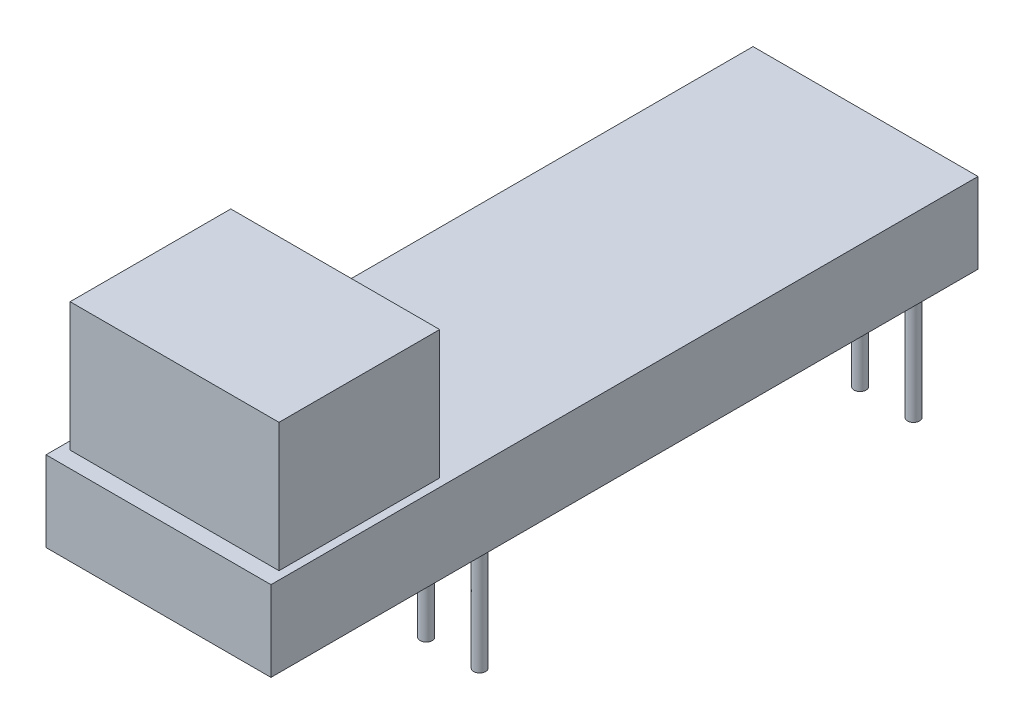
from build123d import *

# Parameters (mm, degrees)
SKETCH2_W           = 14
SKETCH2_H           = 44
BOSS_EXTRUDE1_DEPTH = 5
SKETCH3_W           = 13
SKETCH3_H           = 10
BOSS_EXTRUDE2_DEPTH = 8
SKETCH4_R           = 0.375
BOSS_EXTRUDE3_DEPTH = 8
LPATTERN1_COUNT     = 2
LPATTERN1_PITCH     = 27


with BuildPart() as part:
    # Sketch2 → Boss-Extrude1 (new body)
    with BuildSketch(Plane(origin=(0, 0, 0), x_dir=(1, 0, 0), z_dir=(0, 1, 0))):
        Rectangle(SKETCH2_W, SKETCH2_H)
    extrude(amount=BOSS_EXTRUDE1_DEPTH)

    # Sketch3 → Boss-Extrude2 (add)
    with BuildSketch(Plane(origin=(0, 5, 0), x_dir=(1, 0, 0), z_dir=(0, 1, 0))):
        with Locations((0, -16)):
            Rectangle(SKETCH3_W, SKETCH3_H)
    extrude(amount=BOSS_EXTRUDE2_DEPTH)

    # Sketch4 → Boss-Extrude3 (add)
    with BuildSketch(Plane.XZ):
        with Locations((-5, 7)):
            Circle(SKETCH4_R)
        with Locations((-1.67, 7)):
            Circle(SKETCH4_R)
        with Locations((1.66, 7)):
            Circle(SKETCH4_R)
        with Locations((4.99, 7)):
            Circle(SKETCH4_R)
    boss_extrude3 = extrude(amount=BOSS_EXTRUDE3_DEPTH)

    # LPattern1: Boss-Extrude3 ×2
    with Locations(*[(0, 0, -i * LPATTERN1_PITCH) for i in range(1, LPATTERN1_COUNT)]):
        add(boss_extrude3)


solid = part.part
